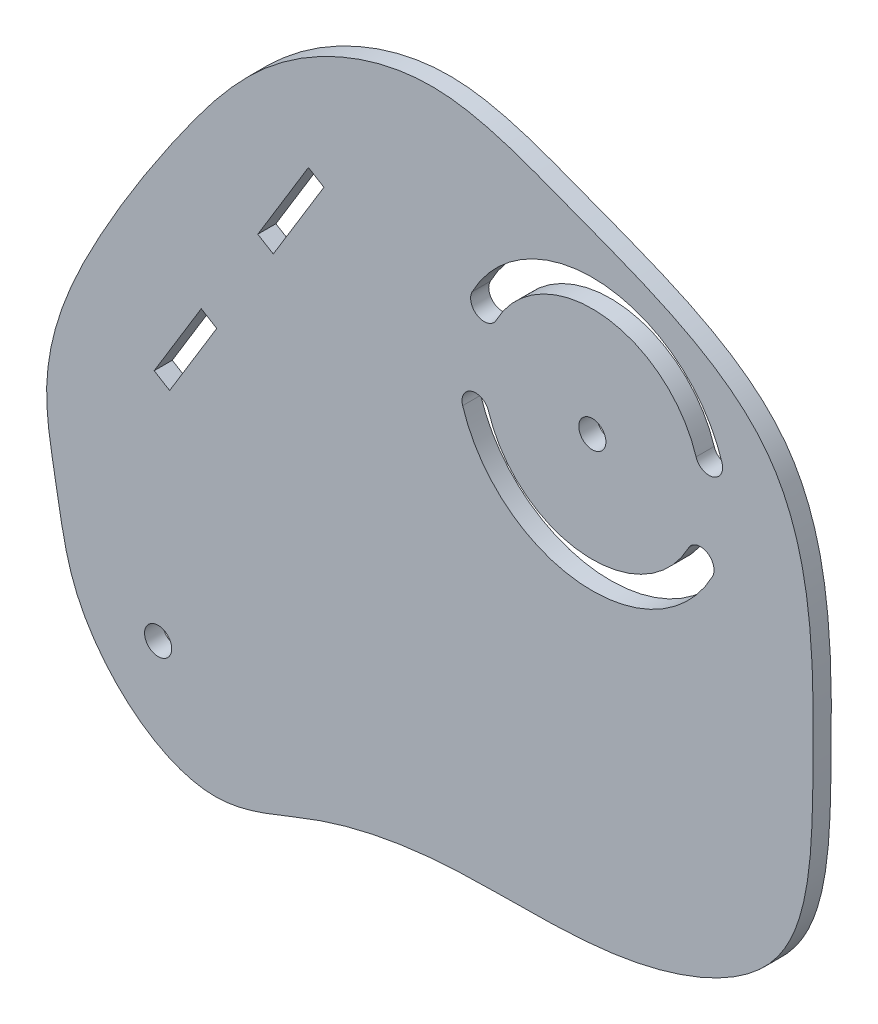
from build123d import *

# Parameters (mm, degrees)
SKETCH1_R           = 2.38125
BOSS_EXTRUDE1_DEPTH = 3.175
CAVITY1_START       = 477.562234694
CAVITY1_OUTLINE_W   = 3.175
CAVITY1_OUTLINE_H   = 3.175
CAVITY1_DEPTH       = 17.070276129
CAVITY1_START_2     = 442.637234694
CAVITY1_2_OUTLINE_W = 3.175
CAVITY1_2_OUTLINE_H = 3.175
CAVITY1_2_DEPTH     = 15.875


# Read off the part's stored shape, not the designer's step: Cavity1
with BuildPart() as part:
    # Sketch1 → Boss-Extrude1 (new body)
    with BuildSketch(Plane.XY):
        with BuildLine():
            add(Edge.make_bspline(
                [(482.231401624, 321.88671593), (472.658750451, 322.009460208), (453.861225957, 314.203680081), (437.291185004, 292.379949666), (422.657620839, 269.573592211), (412.271626808, 246.791013667), (416.37002894, 227.389892698), (419.047324784, 208.369640308), (439.658548571, 189.984116417), (462.453949218, 201.69024677), (486.932445726, 206.242479607), (514.868653349, 203.588097311), (548.237919328, 217.112293197), (548.954385958, 255.942162896), (548.972060183, 300.023132225), (510.176288855, 313.731416792), (490.16672689, 321.784966085), (482.231401624, 321.88671593)],
                knots=[0, 0, 0, 0, 0.070640408, 0.131940246, 0.196256015, 0.269224584, 0.301554992, 0.336790287, 0.409868242, 0.45212738, 0.509949934, 0.589114116, 0.657430538, 0.735994242, 0.845777608, 0.941442072, 1, 1, 1, 1], degree=3))
        make_face()
        with Locations((433.915403324, 213.637909992)):
            Circle(SKETCH1_R, mode=Mode.SUBTRACT)
        with Locations((510.069921301, 283.128571476)):
            Circle(SKETCH1_R, mode=Mode.SUBTRACT)
        with BuildLine():
            ThreePointArc((532.81426555, 290.180518791), (512.258655236, 306.840269011), (489.000761481, 294.224771761))
            ThreePointArc((489.000761481, 294.224771761), (489.998057435, 291.00823575), (493.214593445, 292.005531704))
            ThreePointArc((493.214593445, 292.005531704), (511.820908449, 302.097929504), (528.2653967, 288.770129328))
            ThreePointArc((528.2653967, 288.770129328), (531.245025856, 287.200889635), (532.81426555, 290.180518791))
        make_face(mode=Mode.SUBTRACT)
        with BuildLine():
            ThreePointArc((487.325577052, 276.076624161), (507.881187366, 259.41687394), (531.13908112, 272.032371191))
            ThreePointArc((531.13908112, 272.032371191), (530.141785166, 275.248907201), (526.925249156, 274.251611248))
            ThreePointArc((526.925249156, 274.251611248), (508.318934153, 264.159213448), (491.874445902, 277.487013624))
            ThreePointArc((491.874445902, 277.487013624), (488.894816745, 279.056253317), (487.325577052, 276.076624161))
        make_face(mode=Mode.SUBTRACT)
    extrude(amount=BOSS_EXTRUDE1_DEPTH)

    # Cavity1 outline → Cavity1 (cut)
    with BuildSketch(Plane(origin=(0, 0, 0), x_dir=(0.8539050898948394, -0.5204287630902872, 0), z_dir=(0.5204287630902872, 0.8539050898948394, 0)).offset(CAVITY1_START)):
        with Locations((239.153409968, -1.5875)):
            Rectangle(CAVITY1_OUTLINE_W, CAVITY1_OUTLINE_H)
    extrude(amount=CAVITY1_DEPTH, mode=Mode.SUBTRACT)

    # Cavity1 2 outline → Cavity1 2 (cut)
    with BuildSketch(Plane(origin=(0, 0, 0), x_dir=(0.8539050898948394, -0.5204287630902872, 0), z_dir=(0.5204287630902872, 0.8539050898948394, 0)).offset(CAVITY1_START_2)):
        with Locations((239.153409968, -1.5875)):
            Rectangle(CAVITY1_2_OUTLINE_W, CAVITY1_2_OUTLINE_H)
    extrude(amount=CAVITY1_2_DEPTH, mode=Mode.SUBTRACT)


solid = part.part
